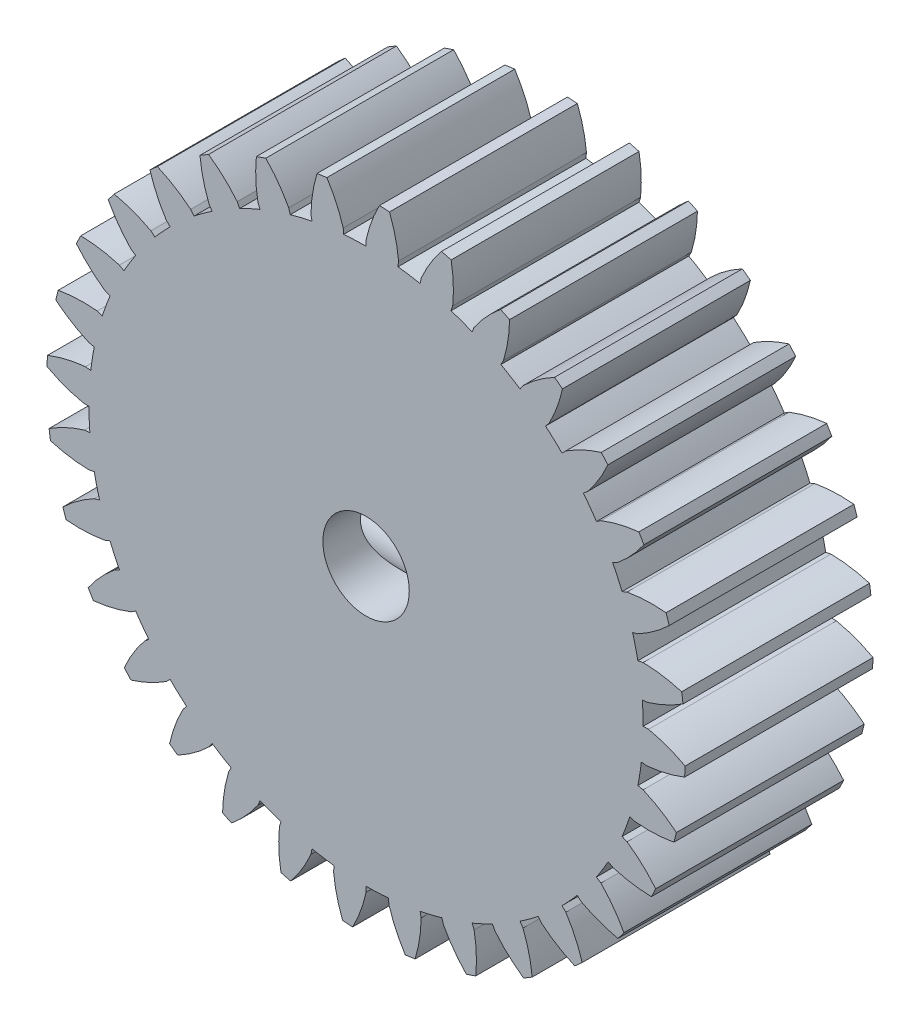
from build123d import *

# Parameters (mm, degrees)
BOSS_EXTRUDE1_DEPTH = 5
CIRPATTERN1_COUNT   = 32
SKETCH6_R           = 7.375
SKETCH6_R_2         = 1.15
BOSS_EXTRUDE3_DEPTH = 5
SKETCH9_R           = 1.5
CUT_EXTRUDE2_DEPTH  = 9
CUT_EXTRUDE3_START  = 1
CUT_EXTRUDE3_DEPTH  = 3


with BuildPart() as part:
    # Sketch3 → Boss-Extrude1 (new body)
    with BuildSketch(Plane.XY):
        with BuildLine():
            Line((0.865619323, 7.467538106), (0.849206214, 7.32594525))
            ThreePointArc((0.849206214, 7.32594525), (0.425310934, 7.362726099), (0, 7.375))
            Line((0, 7.375), (0, 7.517540966))
            ThreePointArc((0, 7.517540966), (0.144610368, 8.017503247), (0.357372444, 8.492484026))
            ThreePointArc((0.357372444, 8.492484026), (0.490188873, 8.485853809), (0.622885322, 8.477146564))
            ThreePointArc((0.622885322, 8.477146564), (0.779539788, 7.980826285), (0.865619323, 7.467538106))
        make_face()
    extrude(amount=BOSS_EXTRUDE1_DEPTH)


with BuildPart() as cirpattern1_1:
    # CirPattern1: pattern copy
    add(part.part.rotate(Axis((0, 0, 0), (0, 0, 1)), 1 * 360 / CIRPATTERN1_COUNT))


with BuildPart() as cirpattern1_2:
    # CirPattern1: pattern copy
    add(part.part.rotate(Axis((0, 0, 0), (0, 0, 1)), 2 * 360 / CIRPATTERN1_COUNT))


with BuildPart() as cirpattern1_3:
    # CirPattern1: pattern copy
    add(part.part.rotate(Axis((0, 0, 0), (0, 0, 1)), 3 * 360 / CIRPATTERN1_COUNT))


with BuildPart() as cirpattern1_4:
    # CirPattern1: pattern copy
    add(part.part.rotate(Axis((0, 0, 0), (0, 0, 1)), 4 * 360 / CIRPATTERN1_COUNT))


with BuildPart() as cirpattern1_5:
    # CirPattern1: pattern copy
    add(part.part.rotate(Axis((0, 0, 0), (0, 0, 1)), 5 * 360 / CIRPATTERN1_COUNT))


with BuildPart() as cirpattern1_6:
    # CirPattern1: pattern copy
    add(part.part.rotate(Axis((0, 0, 0), (0, 0, 1)), 6 * 360 / CIRPATTERN1_COUNT))


with BuildPart() as cirpattern1_7:
    # CirPattern1: pattern copy
    add(part.part.rotate(Axis((0, 0, 0), (0, 0, 1)), 7 * 360 / CIRPATTERN1_COUNT))


with BuildPart() as cirpattern1_8:
    # CirPattern1: pattern copy
    add(part.part.rotate(Axis((0, 0, 0), (0, 0, 1)), 8 * 360 / CIRPATTERN1_COUNT))


with BuildPart() as cirpattern1_9:
    # CirPattern1: pattern copy
    add(part.part.rotate(Axis((0, 0, 0), (0, 0, 1)), 9 * 360 / CIRPATTERN1_COUNT))


with BuildPart() as cirpattern1_10:
    # CirPattern1: pattern copy
    add(part.part.rotate(Axis((0, 0, 0), (0, 0, 1)), 10 * 360 / CIRPATTERN1_COUNT))


with BuildPart() as cirpattern1_11:
    # CirPattern1: pattern copy
    add(part.part.rotate(Axis((0, 0, 0), (0, 0, 1)), 11 * 360 / CIRPATTERN1_COUNT))


with BuildPart() as cirpattern1_12:
    # CirPattern1: pattern copy
    add(part.part.rotate(Axis((0, 0, 0), (0, 0, 1)), 12 * 360 / CIRPATTERN1_COUNT))


with BuildPart() as cirpattern1_13:
    # CirPattern1: pattern copy
    add(part.part.rotate(Axis((0, 0, 0), (0, 0, 1)), 13 * 360 / CIRPATTERN1_COUNT))


with BuildPart() as cirpattern1_14:
    # CirPattern1: pattern copy
    add(part.part.rotate(Axis((0, 0, 0), (0, 0, 1)), 14 * 360 / CIRPATTERN1_COUNT))


with BuildPart() as cirpattern1_15:
    # CirPattern1: pattern copy
    add(part.part.rotate(Axis((0, 0, 0), (0, 0, 1)), 15 * 360 / CIRPATTERN1_COUNT))


with BuildPart() as cirpattern1_16:
    # CirPattern1: pattern copy
    add(part.part.rotate(Axis((0, 0, 0), (0, 0, 1)), 16 * 360 / CIRPATTERN1_COUNT))


with BuildPart() as cirpattern1_17:
    # CirPattern1: pattern copy
    add(part.part.rotate(Axis((0, 0, 0), (0, 0, 1)), 17 * 360 / CIRPATTERN1_COUNT))


with BuildPart() as cirpattern1_18:
    # CirPattern1: pattern copy
    add(part.part.rotate(Axis((0, 0, 0), (0, 0, 1)), 18 * 360 / CIRPATTERN1_COUNT))


with BuildPart() as cirpattern1_19:
    # CirPattern1: pattern copy
    add(part.part.rotate(Axis((0, 0, 0), (0, 0, 1)), 19 * 360 / CIRPATTERN1_COUNT))


with BuildPart() as cirpattern1_20:
    # CirPattern1: pattern copy
    add(part.part.rotate(Axis((0, 0, 0), (0, 0, 1)), 20 * 360 / CIRPATTERN1_COUNT))


with BuildPart() as cirpattern1_21:
    # CirPattern1: pattern copy
    add(part.part.rotate(Axis((0, 0, 0), (0, 0, 1)), 21 * 360 / CIRPATTERN1_COUNT))


with BuildPart() as cirpattern1_22:
    # CirPattern1: pattern copy
    add(part.part.rotate(Axis((0, 0, 0), (0, 0, 1)), 22 * 360 / CIRPATTERN1_COUNT))


with BuildPart() as cirpattern1_23:
    # CirPattern1: pattern copy
    add(part.part.rotate(Axis((0, 0, 0), (0, 0, 1)), 23 * 360 / CIRPATTERN1_COUNT))


with BuildPart() as cirpattern1_24:
    # CirPattern1: pattern copy
    add(part.part.rotate(Axis((0, 0, 0), (0, 0, 1)), 24 * 360 / CIRPATTERN1_COUNT))


with BuildPart() as cirpattern1_25:
    # CirPattern1: pattern copy
    add(part.part.rotate(Axis((0, 0, 0), (0, 0, 1)), 25 * 360 / CIRPATTERN1_COUNT))


with BuildPart() as cirpattern1_26:
    # CirPattern1: pattern copy
    add(part.part.rotate(Axis((0, 0, 0), (0, 0, 1)), 26 * 360 / CIRPATTERN1_COUNT))


with BuildPart() as cirpattern1_27:
    # CirPattern1: pattern copy
    add(part.part.rotate(Axis((0, 0, 0), (0, 0, 1)), 27 * 360 / CIRPATTERN1_COUNT))


with BuildPart() as cirpattern1_28:
    # CirPattern1: pattern copy
    add(part.part.rotate(Axis((0, 0, 0), (0, 0, 1)), 28 * 360 / CIRPATTERN1_COUNT))


with BuildPart() as cirpattern1_29:
    # CirPattern1: pattern copy
    add(part.part.rotate(Axis((0, 0, 0), (0, 0, 1)), 29 * 360 / CIRPATTERN1_COUNT))


with BuildPart() as cirpattern1_30:
    # CirPattern1: pattern copy
    add(part.part.rotate(Axis((0, 0, 0), (0, 0, 1)), 30 * 360 / CIRPATTERN1_COUNT))


with BuildPart() as cirpattern1_31:
    # CirPattern1: pattern copy
    add(part.part.rotate(Axis((0, 0, 0), (0, 0, 1)), 31 * 360 / CIRPATTERN1_COUNT))


with BuildPart() as part_1:
    add(part.part)

    add(cirpattern1_1.part)  # Boss-Extrude3 merges CirPattern1_1

    add(cirpattern1_2.part)  # Boss-Extrude3 merges CirPattern1_2

    add(cirpattern1_3.part)  # Boss-Extrude3 merges CirPattern1_3

    add(cirpattern1_4.part)  # Boss-Extrude3 merges CirPattern1_4

    add(cirpattern1_5.part)  # Boss-Extrude3 merges CirPattern1_5

    add(cirpattern1_6.part)  # Boss-Extrude3 merges CirPattern1_6

    add(cirpattern1_7.part)  # Boss-Extrude3 merges CirPattern1_7

    add(cirpattern1_8.part)  # Boss-Extrude3 merges CirPattern1_8

    add(cirpattern1_9.part)  # Boss-Extrude3 merges CirPattern1_9

    add(cirpattern1_10.part)  # Boss-Extrude3 merges CirPattern1_10

    add(cirpattern1_11.part)  # Boss-Extrude3 merges CirPattern1_11

    add(cirpattern1_12.part)  # Boss-Extrude3 merges CirPattern1_12

    add(cirpattern1_13.part)  # Boss-Extrude3 merges CirPattern1_13

    add(cirpattern1_14.part)  # Boss-Extrude3 merges CirPattern1_14

    add(cirpattern1_15.part)  # Boss-Extrude3 merges CirPattern1_15

    add(cirpattern1_16.part)  # Boss-Extrude3 merges CirPattern1_16

    add(cirpattern1_17.part)  # Boss-Extrude3 merges CirPattern1_17

    add(cirpattern1_18.part)  # Boss-Extrude3 merges CirPattern1_18

    add(cirpattern1_19.part)  # Boss-Extrude3 merges CirPattern1_19

    add(cirpattern1_20.part)  # Boss-Extrude3 merges CirPattern1_20

    add(cirpattern1_21.part)  # Boss-Extrude3 merges CirPattern1_21

    add(cirpattern1_22.part)  # Boss-Extrude3 merges CirPattern1_22

    add(cirpattern1_23.part)  # Boss-Extrude3 merges CirPattern1_23

    add(cirpattern1_24.part)  # Boss-Extrude3 merges CirPattern1_24

    add(cirpattern1_25.part)  # Boss-Extrude3 merges CirPattern1_25

    add(cirpattern1_26.part)  # Boss-Extrude3 merges CirPattern1_26

    add(cirpattern1_27.part)  # Boss-Extrude3 merges CirPattern1_27

    add(cirpattern1_28.part)  # Boss-Extrude3 merges CirPattern1_28

    add(cirpattern1_29.part)  # Boss-Extrude3 merges CirPattern1_29

    add(cirpattern1_30.part)  # Boss-Extrude3 merges CirPattern1_30

    add(cirpattern1_31.part)  # Boss-Extrude3 merges CirPattern1_31
    # Sketch6 → Boss-Extrude3 (add)
    with BuildSketch(Plane.XY):
        Circle(SKETCH6_R)
        Circle(SKETCH6_R_2, mode=Mode.SUBTRACT)
    extrude(amount=BOSS_EXTRUDE3_DEPTH)

    # Sketch9 → Cut-Extrude2 (cut)
    with BuildSketch(Plane(origin=(0, 0, 0), x_dir=(0, 0, -1), z_dir=(1, 0, 0))):
        with Locations((-2.5, 0)):
            Circle(SKETCH9_R)
    extrude(amount=-CUT_EXTRUDE2_DEPTH, mode=Mode.SUBTRACT)

    # Cut-Extrude3: read off the stored shape, not the designer's step
    # Cut-Extrude3 outline → Cut-Extrude3 (cut)
    with BuildSketch(Plane.XY.offset(CUT_EXTRUDE3_START)):
        with BuildLine():
            ThreePointArc((-7.375, 0), (-7.362726099, 0.425310934), (-7.32594525, 0.849206214))
            Line((-7.32594525, 0.849206214), (-7.467538106, 0.865619323))
            ThreePointArc((-7.467538106, 0.865619323), (-7.980826285, 0.779539788), (-8.477146564, 0.622885322))
            ThreePointArc((-8.477146564, 0.622885322), (-8.485853809, 0.490188873), (-8.492484026, 0.357372444))
            ThreePointArc((-8.492484026, 0.357372444), (-8.017503247, 0.144610368), (-7.517540966, 0))
            Line((-7.517540966, 0), (-7.375, 0))
        make_face()
        with BuildLine():
            ThreePointArc((-7.448064611, 1.5), (-7.410670895, 1.483093628), (-7.373093525, 1.466599488))
            Line((-7.373093525, 1.466599488), (-7.233291443, 1.438791125))
            ThreePointArc((-7.233291443, 1.438791125), (-7.2271338, 1.469408737), (-7.220846557, 1.5))
            Line((-7.220846557, 1.5), (-7.448064611, 1.5))
        make_face()
        with BuildLine():
            ThreePointArc((-8.399023232, -1.306295811), (-7.891661254, -1.42230557), (-7.373093525, -1.466599488))
            Line((-7.373093525, -1.466599488), (-7.233291443, -1.438791125))
            ThreePointArc((-7.233291443, -1.438791125), (-7.304227429, -1.019257902), (-7.35085118, -0.596332063))
            Line((-7.35085118, -0.596332063), (-7.492925408, -0.607857724))
            ThreePointArc((-7.492925408, -0.607857724), (-7.979557615, -0.79242082), (-8.435779468, -1.042892498))
            ThreePointArc((-8.435779468, -1.042892498), (-8.418431613, -1.174737921), (-8.399023232, -1.306295811))
        make_face()
    extrude(amount=CUT_EXTRUDE3_DEPTH, mode=Mode.SUBTRACT)


solid = part_1.part
